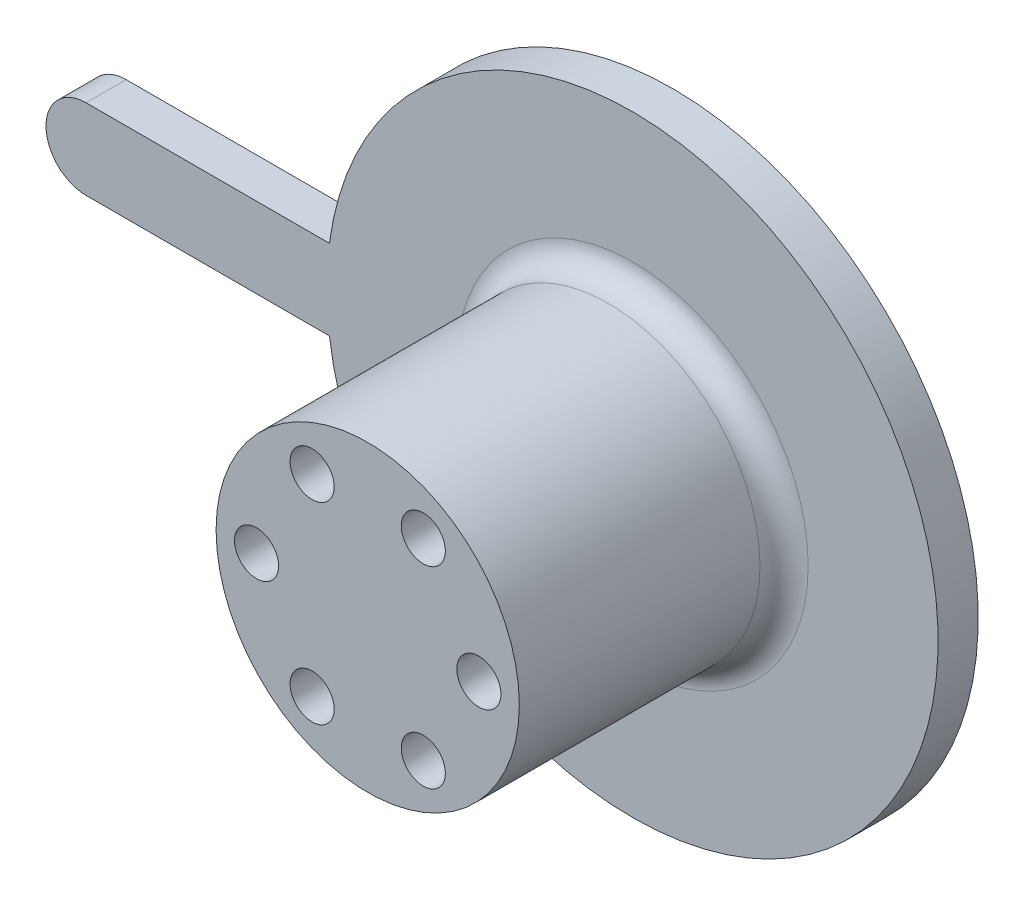
from build123d import *

# Parameters (mm, degrees)
BOSS_EXTRUDE3_DEPTH = 5
SKETCH5_R           = 18.9
BOSS_EXTRUDE4_DEPTH = 33
FILLET4_R           = 3
SKETCH6_R           = 2.75
CUT_EXTRUDE4_DEPTH  = 39.48


with BuildPart() as part:
    # Sketch4 → Boss-Extrude3 (new body)
    with BuildSketch(Plane.XY):
        with BuildLine():
            Line((-68.1, -5), (-37.770491127, -5))
            ThreePointArc((-37.770491127, -5), (38.1, 0), (-37.770491127, 5))
            Line((-37.770491127, 5), (-68.1, 5))
            ThreePointArc((-68.1, 5), (-73.1, 0), (-68.1, -5))
        make_face()
    extrude(amount=BOSS_EXTRUDE3_DEPTH)

    # Sketch5 → Boss-Extrude4 (add)
    with BuildSketch(Plane.XY.offset(5)):
        Circle(SKETCH5_R)
    extrude(amount=BOSS_EXTRUDE4_DEPTH)

    # Fillet4
    fillet4_edges = [part.edges().sort_by_distance(p)[0] for p in [
        (-18.9, 0, 5),
    ]]
    fillet(fillet4_edges, radius=FILLET4_R)

    # Sketch6 → Cut-Extrude4 (cut)
    with BuildSketch(Plane.XY.offset(38)):
        with Locations((-13.856406461, 0)):
            Circle(SKETCH6_R)
        with Locations((-6.92820323, -12)):
            Circle(SKETCH6_R)
        with Locations((-6.92820323, 12)):
            Circle(SKETCH6_R)
        with Locations((6.92820323, -12)):
            Circle(SKETCH6_R)
        with Locations((6.92820323, 12)):
            Circle(SKETCH6_R)
        with Locations((13.856406461, 0)):
            Circle(SKETCH6_R)
    extrude(amount=-CUT_EXTRUDE4_DEPTH, mode=Mode.SUBTRACT)


solid = part.part
